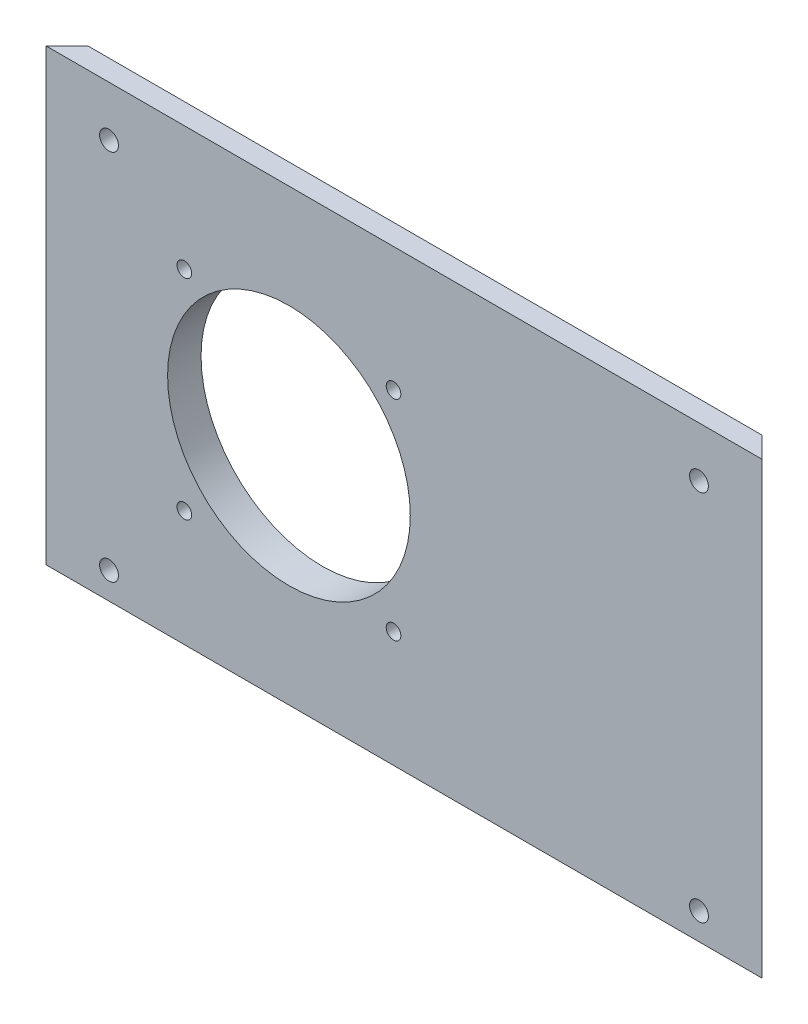
from build123d import *

# Parameters (mm, degrees)
SKETCH1_W           = 171
SKETCH1_H           = 110
SKETCH1_R           = 2.25
BOSS_EXTRUDE1_DEPTH = 5
SKETCH2_W           = 171
SKETCH2_H           = 105
SKETCH2_R           = 2.25
BOSS_EXTRUDE2_DEPTH = 3
CHAMFER1_SIZE       = 8
CHAMFER3_SIZE       = 3
SKETCH3_W           = 7.071067812
SKETCH3_H           = 2.6
CUT_EXTRUDE1_DEPTH  = 232.587308883
SKETCH4_R           = 29
SKETCH4_R_2         = 1.75
CUT_EXTRUDE2_DEPTH  = 204.482185952


with BuildPart() as part:
    # Sketch1 → Boss-Extrude1 (new body)
    with BuildSketch(Plane.XY):
        with Locations((85.5, 55)):
            Rectangle(SKETCH1_W, SKETCH1_H)
        with Locations((15, 9)):
            Circle(SKETCH1_R, mode=Mode.SUBTRACT)
        with Locations(Location((156, 9, 0), (0, 0, 180))):
            Circle(SKETCH1_R, mode=Mode.SUBTRACT)
        with Locations((15, 98)):
            Circle(SKETCH1_R, mode=Mode.SUBTRACT)
        with Locations(Location((156, 98, 0), (0, 0, 180))):
            Circle(SKETCH1_R, mode=Mode.SUBTRACT)
    extrude(amount=-BOSS_EXTRUDE1_DEPTH)

    # Sketch2 → Boss-Extrude2 (add)
    with BuildSketch(Plane(origin=(0, 0, -5), x_dir=(-1, 0, 0), z_dir=(0, 0, -1))):
        with Locations((-85.5, 57.5)):
            Rectangle(SKETCH2_W, SKETCH2_H)
        with Locations(Location((-15, 9, 0), (0, 0, 180))):
            Circle(SKETCH2_R, mode=Mode.SUBTRACT)
        with Locations((-156, 9)):
            Circle(SKETCH2_R, mode=Mode.SUBTRACT)
        with Locations(Location((-15, 98, 0), (0, 0, 180))):
            Circle(SKETCH2_R, mode=Mode.SUBTRACT)
        with Locations((-156, 98)):
            Circle(SKETCH2_R, mode=Mode.SUBTRACT)
    extrude(amount=BOSS_EXTRUDE2_DEPTH)

    # Chamfer1
    # the kernel refuses this chamfer: 8 mm, written as the material it takes off along each edge
    with BuildSketch(Plane(origin=(171, -15.573463904, -8), x_dir=(-0.9996219169112968, 0, -0.027495876610586296), z_dir=(0, 1, 0)), Plane(origin=(0, 130.573463904, -8), x_dir=(0.9996219169112968, 0, -0.027495876610586275), z_dir=(0, -1, 0))) as chamfer1_piece_1:
        Polygon((CHAMFER1_SIZE * 0.999621916911, CHAMFER1_SIZE * 0.0274958766106), (-CHAMFER1_SIZE * 0.0274958766106, CHAMFER1_SIZE * 0.999621916911), (0, 0), align=None)
    extrude(amount=146.146927807, mode=Mode.SUBTRACT)

    # Chamfer3
    chamfer3_edges = [part.edges().sort_by_distance(p)[0] for p in [
        (85.5, 110, -8),
    ]]
    chamfer(chamfer3_edges, length=CHAMFER3_SIZE)

    # Sketch3 → Cut-Extrude1 (cut, through all, along a direction that is not the sketch's normal)
    with BuildSketch(Plane(origin=(85.5, 0, -85.5), x_dir=(-0.7071067811865452, 0, -0.7071067811865498), z_dir=(0.7071067811865498, 0, -0.7071067811865452))):
        with Locations((-117.379725677, 1.3)):
            Rectangle(SKETCH3_W, SKETCH3_H)
    extrude(amount=-CUT_EXTRUDE1_DEPTH, dir=(1, 0, 0), mode=Mode.SUBTRACT)

    # Sketch4 → Cut-Extrude2 (cut, through all)
    with BuildSketch(Plane.XY):
        with Locations((58, 56.3)):
            Circle(SKETCH4_R)
        with Locations((33, 80.3)):
            Circle(SKETCH4_R_2)
        with Locations((83, 80.3)):
            Circle(SKETCH4_R_2)
        with Locations((83, 30.3)):
            Circle(SKETCH4_R_2)
        with Locations((33, 30.3)):
            Circle(SKETCH4_R_2)
    extrude(amount=-CUT_EXTRUDE2_DEPTH, mode=Mode.SUBTRACT)


solid = part.part
